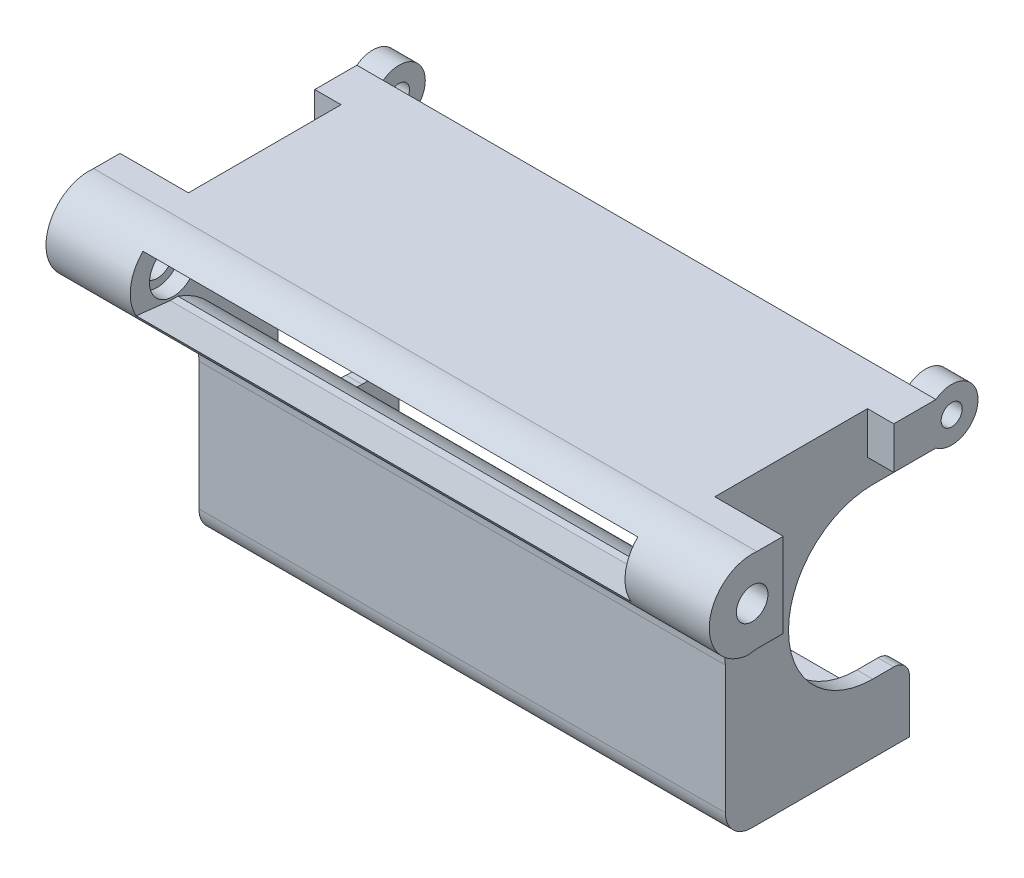
from build123d import *

# Parameters (mm, degrees)
SKETCH_1_W                = 126
SKETCH_1_H                = 16
SKETCH_1_W_2              = 120
SKETCH_1_H_2              = 10
EXTRUDE_1_DEPTH           = 70
SKETCH_2_W                = 5.409722794
SKETCH_2_H                = 10
EXTRUDE_2_DEPTH           = 70
FILLET_4_R                = 3
FILLET_5_R                = 3
SKETCH_5_W                = 9
SKETCH_5_H                = 7
SKETCH_5_R                = 1.6
EXTRUDE_3_DEPTH           = 4
FILLET_7_R                = 2
CUT_EXTRUDE_2_DEPTH       = 4
FILLET_11_R               = 2
FILLET_12_R               = 2
SKETCH_9_W                = 126
SKETCH_9_H                = 16
SKETCH_9_W_2              = 120
SKETCH_9_H_2              = 10
EXTRUDE_4_DEPTH           = 5
SKETCH_10_W               = 100
SKETCH_10_H               = 16
SKETCH_10_W_2             = 94
SKETCH_10_H_2             = 10
EXTRUDE_5_DEPTH           = 7
SKETCH_11_W               = 10
SKETCH_11_H               = 10
EXTRUDE_6_DEPTH           = 5
SKETCH_13_W               = 28
SKETCH_13_H               = 58
EXTRUDE_7_DEPTH           = 100
SKETCH_14_W               = 94
SKETCH_14_H               = 52
CUT_EXTRUDE_3_DEPTH       = 25
SKETCH_15_W               = 94
SKETCH_15_H               = 10
CUT_EXTRUDE_4_DEPTH       = 32
SKETCH_18_W               = 40
SKETCH_18_H               = 18
CUT_EXTRUDE_6_DEPTH       = 12
SKETCH_20_R               = 16
CUT_EXTRUDE_8_DEPTH       = 150.278263655
FILLET_14_R               = 3
FILLET_15_R               = 15
FILLET_16_R               = 15
CUT_EXTRUDE_9_DEPTH       = 35
SKETCH_23_W               = 13
SKETCH_23_H               = 5
SKETCH_23_W_2             = 10
EXTRUDE_9_DEPTH           = 5.761663039
EXTRUDE_10_REACH          = 162.078
SKETCH_27_W               = 94
SKETCH_27_H               = 10
CUT_EXTRUDE_11_DEPTH      = 5
SKETCH_29_W               = 9
SKETCH_29_H               = 7
SKETCH_29_R               = 1.6
EXTRUDE_11_DEPTH          = 4
FILLET_19_R               = 2
FILLET_20_R               = 2
FILLET_21_R               = 5
FILLET_22_R               = 5
CUT_EXTRUDE_12_DEPTH      = 161.078105936
CUT_EXTRUDE_12_DEPTH_BACK = 161.078105936
SKETCH_30_W               = 79.362273543
SKETCH_30_H               = 24.541256895
EXTRUDE_12_DEPTH          = 7
SKETCH_32_W               = 8.862682936
SKETCH_32_H               = 4
SKETCH_32_W_2             = 8.304403695
SKETCH_32_W_3             = 4.885807457
EXTRUDE_13_DEPTH          = 7
FILLET_23_R               = 2
FILLET_24_R               = 2
SKETCH_33_W               = 3
SKETCH_33_H               = 10
EXTRUDE_14_DEPTH          = 3
FILLET_25_R               = 3
FILLET_26_R               = 3
CUT_EXTRUDE_13_DEPTH      = 94
FILLET_27_R               = 30
SKETCH_35_W               = 3
SKETCH_35_H               = 5.761663039
EXTRUDE_15_DEPTH          = 5
SKETCH_36_W               = 19.403714678
SKETCH_36_H               = 18.643079651
SKETCH_36_W_2             = 20.912307645
SKETCH_36_H_2             = 24.781751374
CUT_EXTRUDE_14_DEPTH      = 10
EXTRUDE_16_DEPTH          = 126
SKETCH_38_W               = 94
SKETCH_38_H               = 10.061832231
CUT_EXTRUDE_15_DEPTH      = 10
SKETCH_39_R               = 4.5
CUT_EXTRUDE_16_DEPTH      = 50
CUT_EXTRUDE_17_DEPTH      = 146.189531303
CUT_EXTRUDE_17_DEPTH_BACK = 146.189531303
SKETCH_40_R               = 3
SKETCH_41_W               = 3
SKETCH_41_H               = 8
EXTRUDE_17_DEPTH          = 5
CUT_EXTRUDE_18_DEPTH      = 138.364478669
CUT_EXTRUDE_18_DEPTH_BACK = 138.364478669
SKETCH_42_R               = 2


with BuildPart() as part:
    # 草图1 → 凸台-拉伸1 (new body)
    with BuildSketch(Plane.XY):
        Rectangle(SKETCH_1_W, SKETCH_1_H)
        Rectangle(SKETCH_1_W_2, SKETCH_1_H_2, mode=Mode.SUBTRACT)
    extrude(amount=EXTRUDE_1_DEPTH)

    # 草图2 → 凸台-拉伸2 (add)
    with BuildSketch(Plane.XY.offset(70)):
        Rectangle(SKETCH_2_W, SKETCH_2_H)
    extrude(amount=-EXTRUDE_2_DEPTH)

    # 圆角4
    fillet_4_edges = [part.edges().sort_by_distance(p)[0] for p in [
        (-2.704861397, -5, 35),
    ]]
    fillet(fillet_4_edges, radius=FILLET_4_R)

    # 圆角5
    fillet_5_edges = [part.edges().sort_by_distance(p)[0] for p in [
        (-2.704861397, 5, 35),
    ]]
    fillet(fillet_5_edges, radius=FILLET_5_R)

    # 草图5 → 凸台-拉伸3 (add)
    with BuildSketch(Plane(origin=(0, 0, 2), x_dir=(-1, 0, 0), z_dir=(0, 0, -1))):
        with Locations((-67.5, 0)):
            Rectangle(SKETCH_5_W, SKETCH_5_H)
        with Locations((-69, 0)):
            Circle(SKETCH_5_R, mode=Mode.SUBTRACT)
    extrude(amount=-EXTRUDE_3_DEPTH)

    # 圆角7
    fillet_7_edges = [part.edges().sort_by_distance(p)[0] for p in [
        (72, -3.5, 4),
        (72, 3.5, 4),
        (63, 3.5, 4),
        (63, -3.5, 4),
    ]]
    fillet(fillet_7_edges, radius=FILLET_7_R)

    # 镜向8: part across plane


with BuildPart() as part_1:
    add(part.part)
    add(part.part.mirror(Plane(origin=(0, 0, 0), x_dir=(0, 0, 1), z_dir=(1, 0, 0))))

    # 镜向11: part across plane


with BuildPart() as part_2:
    add(part_1.part)
    add(part_1.part.mirror(Plane(origin=(0, 0, 35), x_dir=(1, 0, 0), z_dir=(0, 0, -1))))

    # 草图7 → 切除-拉伸2 (cut)
    with BuildSketch(Plane.XZ.offset(8)):
        with BuildLine():
            Line((-43.6, 21), (-43.6, 9))
            ThreePointArc((-43.6, 9), (-42, 7.4), (-40.4, 9))
            Line((-40.4, 9), (-40.4, 21))
            ThreePointArc((-40.4, 21), (-42, 22.6), (-43.6, 21))
        make_face()
        with BuildLine():
            Line((-26.6, 21), (-26.6, 9))
            ThreePointArc((-26.6, 9), (-25, 7.4), (-23.4, 9))
            Line((-23.4, 9), (-23.4, 21))
            ThreePointArc((-23.4, 21), (-25, 22.6), (-26.6, 21))
        make_face()
        with BuildLine():
            Line((23.4, 21), (23.4, 9))
            ThreePointArc((23.4, 9), (25, 7.4), (26.6, 9))
            Line((26.6, 9), (26.6, 21))
            ThreePointArc((26.6, 21), (25, 22.6), (23.4, 21))
        make_face()
        with BuildLine():
            Line((40.4, 21), (40.4, 9))
            ThreePointArc((40.4, 9), (42, 7.4), (43.6, 9))
            Line((43.6, 9), (43.6, 21))
            ThreePointArc((43.6, 21), (42, 22.6), (40.4, 21))
        make_face()
    extrude(amount=-CUT_EXTRUDE_2_DEPTH, mode=Mode.SUBTRACT)

    # 圆角11
    fillet_11_edges = [part_2.edges().sort_by_distance(p)[0] for p in [
        (2.704861397, 0, 0),
        (32.852430699, -5, 0),
        (3.583541054, -4.121320344, 0),
        (3.583541054, 4.121320344, 0),
        (-60, 0, 0),
        (-32.852430699, -5, 0),
        (60, 0, 0),
        (32.852430699, 5, 0),
        (-3.583541054, -4.121320344, 0),
        (-32.852430699, 5, 0),
        (-2.704861397, 0, 0),
        (-3.583541054, 4.121320344, 0),
    ]]
    fillet(fillet_11_edges, radius=FILLET_11_R)

    # 圆角12
    fillet_12_edges = [part_2.edges().sort_by_distance(p)[0] for p in [
        (2.704861397, 0, 70),
        (32.852430699, -5, 70),
        (3.583541054, -4.121320344, 70),
        (3.583541054, 4.121320344, 70),
        (-60, 0, 70),
        (-32.852430699, -5, 70),
        (60, 0, 70),
        (32.852430699, 5, 70),
        (-3.583541054, -4.121320344, 70),
        (-32.852430699, 5, 70),
        (-2.704861397, 0, 70),
        (-3.583541054, 4.121320344, 70),
    ]]
    fillet(fillet_12_edges, radius=FILLET_12_R)

    # 草图30 → 切除-拉伸12 (cut, two sides: drawn at the far end of the back side and taken through both)
    with BuildSketch(Plane(origin=(63, 0, 0), x_dir=(0, 0, -1), z_dir=(1, 0, 0)).offset(-CUT_EXTRUDE_12_DEPTH_BACK)):
        with Locations((-36.613921576, 1.105672462)):
            Rectangle(SKETCH_30_W, SKETCH_30_H)
    extrude(amount=CUT_EXTRUDE_12_DEPTH + CUT_EXTRUDE_12_DEPTH_BACK, mode=Mode.SUBTRACT)


with BuildPart() as body_2:
    # 草图9 → 凸台-拉伸4 (new body)
    with BuildSketch(Plane(origin=(0, 0, -10), x_dir=(-1, 0, 0), z_dir=(0, 0, -1))):
        Rectangle(SKETCH_9_W, SKETCH_9_H)
        Rectangle(SKETCH_9_W_2, SKETCH_9_H_2, mode=Mode.SUBTRACT)
    extrude(amount=EXTRUDE_4_DEPTH)

    # 草图10 → 凸台-拉伸5 (add)
    with BuildSketch(Plane(origin=(0, 0, -10), x_dir=(-1, 0, 0), z_dir=(0, 0, -1))):
        Rectangle(SKETCH_10_W, SKETCH_10_H)
        Rectangle(SKETCH_10_W_2, SKETCH_10_H_2, mode=Mode.SUBTRACT)
    extrude(amount=EXTRUDE_5_DEPTH)

    # 草图11 → 凸台-拉伸6 (add)
    with BuildSketch(Plane(origin=(0, 0, -15), x_dir=(-1, 0, 0), z_dir=(0, 0, -1))):
        with Locations((55, 0)):
            Rectangle(SKETCH_11_W, SKETCH_11_H)
        with Locations((-55, 0)):
            Rectangle(SKETCH_11_W, SKETCH_11_H)
    extrude(amount=-EXTRUDE_6_DEPTH)

    # 草图13 → 凸台-拉伸7 (add)
    with BuildSketch(Plane.ZY.offset(50)):
        with Locations((-31, -21)):
            Rectangle(SKETCH_13_W, SKETCH_13_H)
    extrude(amount=-EXTRUDE_7_DEPTH)

    # 草图14 → 切除-拉伸3 (cut)
    with BuildSketch(Plane(origin=(0, 0, -45), x_dir=(-1, 0, 0), z_dir=(0, 0, -1))):
        with Locations((0, -21)):
            Rectangle(SKETCH_14_W, SKETCH_14_H)
    extrude(amount=-CUT_EXTRUDE_3_DEPTH, mode=Mode.SUBTRACT)

    # 草图15 → 切除-拉伸4 (cut)
    with BuildSketch(Plane.XY.offset(-17)):
        Rectangle(SKETCH_15_W, SKETCH_15_H)
    extrude(amount=-CUT_EXTRUDE_4_DEPTH, mode=Mode.SUBTRACT)

    # 草图18 → 切除-拉伸6 (cut)
    with BuildSketch(Plane.XZ.offset(50)):
        with Locations((0, -36)):
            Rectangle(SKETCH_18_W, SKETCH_18_H)
    extrude(amount=-CUT_EXTRUDE_6_DEPTH, mode=Mode.SUBTRACT)

    # 草图20 → 切除-拉伸8 (cut, through all)
    with BuildSketch(Plane(origin=(50, 0, 0), x_dir=(0, 0, -1), z_dir=(1, 0, 0))):
        with Locations((45, -21)):
            Circle(SKETCH_20_R)
    extrude(amount=-CUT_EXTRUDE_8_DEPTH, mode=Mode.SUBTRACT)

    # 圆角14
    fillet_14_edges = [body_2.edges().sort_by_distance(p)[0] for p in [
        (-20, -48.5, -27),
        (20, -48.5, -27),
        (20, -48.5, -45),
        (-20, -48.5, -45),
    ]]
    fillet(fillet_14_edges, radius=FILLET_14_R)

    # 圆角15
    # the kernel refuses this fillet: 15 mm, written as the material it adds along each edge
    with BuildSketch(Plane(origin=(-81.721443851, -8, -17), x_dir=(0, -1, 0), z_dir=(1, 0, 0))) as fillet_15_piece_1_section:
        with BuildLine():
            CenterArc((12.68857754, -15), FILLET_15_R, 90, 57.769047364)
            Line((0, -7), (-0.253771551, -6.84))
            ThreePointArc((-0.253771551, -6.84), (-0.3, -3.5), (-0.3, 0))
            Line((-0.3, 0), (0, 0.3))
            Line((0, 0.3), (12.68857754, 0.3))
            Line((12.68857754, 0.3), (12.68857754, 0))
        make_face()
    fillet_15_piece_1 = extrude(amount=131.721443851, mode=Mode.PRIVATE)
    fillet_15_piece_1 = split(fillet_15_piece_1, bisect_by=Plane(origin=(-50, -9.390389411, -13.373048473), z_dir=(-1, 0, 0)), keep=Keep.TOP, mode=Mode.PRIVATE)
    fillet_15_piece_1 = split(fillet_15_piece_1, bisect_by=Plane(origin=(-63, -9.390389411, -13.373048473), z_dir=(1, 0, 0)), keep=Keep.TOP, mode=Mode.PRIVATE)
    fillet_15_piece_1 = split(fillet_15_piece_1, bisect_by=Plane(origin=(-56.5, -9.390389411, -15), z_dir=(0, 0, 1)), keep=Keep.TOP, mode=Mode.PRIVATE)
    add(fillet_15_piece_1)
    with BuildSketch(Plane(origin=(-50, -8, -17), x_dir=(0, -1, 0), z_dir=(1, 0, 0))) as fillet_15_piece_2_section:
        with BuildLine():
            CenterArc((12.68857754, -15), FILLET_15_R, 90, 57.769047365)
            Line((0, -7), (-0.253771551, -6.84))
            ThreePointArc((-0.253771551, -6.84), (-0.3, -3.5), (-0.3, 0))
            Line((-0.3, 0), (0, 0.3))
            Line((0, 0.3), (12.68857754, 0.3))
            Line((12.68857754, 0.3), (12.68857754, 0))
        make_face()
    fillet_15_piece_2 = extrude(amount=100, mode=Mode.PRIVATE)
    fillet_15_piece_2 = split(fillet_15_piece_2, bisect_by=Plane(origin=(0, -12.327149121, -15), z_dir=(0, 0, -1)), keep=Keep.TOP, mode=Mode.PRIVATE)
    add(fillet_15_piece_2)
    with BuildSketch(Plane(origin=(-50, -8, -17), x_dir=(0, -1, 0), z_dir=(1, 0, 0))) as fillet_15_piece_3_section:
        with BuildLine():
            CenterArc((12.68857754, -15), FILLET_15_R, 90, 57.769047365)
            Line((0, -7), (-0.253771551, -6.84))
            ThreePointArc((-0.253771551, -6.84), (-0.3, -3.5), (-0.3, 0))
            Line((-0.3, 0), (0, 0.3))
            Line((0, 0.3), (12.68857754, 0.3))
            Line((12.68857754, 0.3), (12.68857754, 0))
        make_face()
    fillet_15_piece_3 = extrude(amount=100, mode=Mode.PRIVATE)
    fillet_15_piece_3 = split(fillet_15_piece_3, bisect_by=Plane(origin=(0, -9.390389411, -15), z_dir=(0, 0, 1)), keep=Keep.TOP, mode=Mode.PRIVATE)
    add(fillet_15_piece_3)
    with BuildSketch(Plane(origin=(-50, -8, -17), x_dir=(0, -1, 0), z_dir=(1, 0, 0))) as fillet_15_piece_4_section:
        with BuildLine():
            CenterArc((12.68857754, -15), FILLET_15_R, 90, 57.769047365)
            Line((0, -7), (-0.253771551, -6.84))
            ThreePointArc((-0.253771551, -6.84), (-0.3, -3.5), (-0.3, 0))
            Line((-0.3, 0), (0, 0.3))
            Line((0, 0.3), (12.68857754, 0.3))
            Line((12.68857754, 0.3), (12.68857754, 0))
        make_face()
    fillet_15_piece_4 = extrude(amount=131.721443851, mode=Mode.PRIVATE)
    fillet_15_piece_4 = split(fillet_15_piece_4, bisect_by=Plane(origin=(50, -9.390389411, -13.373048473), z_dir=(1, 0, 0)), keep=Keep.TOP, mode=Mode.PRIVATE)
    fillet_15_piece_4 = split(fillet_15_piece_4, bisect_by=Plane(origin=(56.5, -9.390389411, -15), z_dir=(0, 0, 1)), keep=Keep.TOP, mode=Mode.PRIVATE)
    fillet_15_piece_4 = split(fillet_15_piece_4, bisect_by=Plane(origin=(63, -9.390389411, -13.373048473), z_dir=(-1, 0, 0)), keep=Keep.TOP, mode=Mode.PRIVATE)
    add(fillet_15_piece_4)

    # 圆角16
    # the kernel refuses this fillet: 15 mm, written as the material it takes off along each edge
    with BuildSketch(Plane(origin=(-47, -5, -20), x_dir=(0, -1, 0), z_dir=(1, 0, 0))) as fillet_16_piece_1:
        with BuildLine():
            CenterArc((14.142135624, -15), FILLET_16_R, 90, 70.528779366)
            Line((0, -10), (0, 0))
            Line((0, 0), (14.142135624, 0))
        make_face()
    extrude(amount=94, mode=Mode.SUBTRACT)

    # 草图22 → 切除-拉伸9 (cut)
    with BuildSketch(Plane(origin=(0, 0, -10), x_dir=(-1, 0, 0), z_dir=(0, 0, -1))):
        Polygon((-50, -2.238336961), (-63, -2.238336961), (-70.122291953, -2.238336961), (-70.122291953, -20.130209913), (-50, -20.130209913), align=None)
        Polygon((63, -2.238336961), (50, -2.238336961), (50, -24.248491671), (70.402947552, -24.248491671), (70.402947552, -2.238336961), align=None)
    extrude(amount=CUT_EXTRUDE_9_DEPTH, mode=Mode.SUBTRACT)

    # 草图23 → 凸台-拉伸9 (add)
    with BuildSketch(Plane.XZ.offset(2.238336961)):
        with Locations((56.5, -12.5)):
            Rectangle(SKETCH_23_W, SKETCH_23_H)
        with Locations((-58, -12.5)):
            Rectangle(SKETCH_23_W_2, SKETCH_23_H)
    extrude(amount=EXTRUDE_9_DEPTH)

    # 凸台-拉伸10: up to this face of the body (flat: up to its plane)
    extrude_10_end = Plane(body_2.part.faces().sort_by_distance((63, 0, -12.5))[0])
    # 草图26 → 凸台-拉伸10 (add, up to the picked face)
    with BuildSketch(Plane.ZY.offset(63), mode=Mode.PRIVATE) as extrude_10_sk1:
        Polygon((-10, -8), (-10, 8), (-8.195004029, -8.206285254), align=None)
    extrude_10_tool1 = split(extrude(extrude_10_sk1.sketch, amount=-EXTRUDE_10_REACH, mode=Mode.PRIVATE), bisect_by=extrude_10_end, keep=Keep.BOTH, mode=Mode.PRIVATE)
    add(extrude_10_tool1.solids().sort_by(Axis((-63, -2.735428, -9.398335), (1, 0, 0)))[0])

    # 草图27 → 切除-拉伸11 (cut)
    with BuildSketch(Plane(origin=(0, 0, -10), x_dir=(-1, 0, 0), z_dir=(0, 0, -1))):
        Rectangle(SKETCH_27_W, SKETCH_27_H)
    extrude(amount=-CUT_EXTRUDE_11_DEPTH, mode=Mode.SUBTRACT)

    # 草图29 → 凸台-拉伸11 (add)
    # profile 1 of 2: a face of its own
    with BuildSketch(Plane(origin=(0, -1.555554136, -13.966653921), x_dir=(1, 0, 0), z_dir=(0, 0.11069186028527712, 0.993854774132813))):
        with Locations((-67.5, 1.660377904)):
            Rectangle(SKETCH_29_W, SKETCH_29_H)
        with Locations(Location((-69, 1.660377904, 0), (0, 0, 270))):
            Circle(SKETCH_29_R, mode=Mode.SUBTRACT)
    # profile 2 of 2: a face of its own
    with BuildSketch(Plane(origin=(0, -1.555554136, -13.966653921), x_dir=(1, 0, 0), z_dir=(0, 0.11069186028527712, 0.993854774132813))):
        with Locations((67.5, 1.660377904)):
            Rectangle(SKETCH_29_W, SKETCH_29_H)
        with Locations(Location((69, 1.660377904, 0), (0, 0, 270))):
            Circle(SKETCH_29_R, mode=Mode.SUBTRACT)
    extrude(amount=EXTRUDE_11_DEPTH)

    # 圆角19
    fillet_19_edges = [body_2.edges().sort_by_distance(p)[0] for p in [
        (63, -3.162487618, -11.775313181),
        (72, -3.162487618, -11.775313181),
        (72, 3.794495801, -12.550156203),
        (63, 3.794495801, -12.550156203),
    ]]
    fillet(fillet_19_edges, radius=FILLET_19_R)

    # 圆角20
    fillet_20_edges = [body_2.edges().sort_by_distance(p)[0] for p in [
        (-63, -3.162487618, -11.775313181),
        (-63, 3.794495801, -12.550156203),
        (-72, 3.794495801, -12.550156203),
        (-72, -3.162487618, -11.775313181),
    ]]
    fillet(fillet_20_edges, radius=FILLET_20_R)

    # 圆角21
    fillet_21_edges = [body_2.edges().sort_by_distance(p)[0] for p in [
        (0, -50, -17),
    ]]
    fillet(fillet_21_edges, radius=FILLET_21_R)

    # 圆角22
    fillet_22_edges = [body_2.edges().sort_by_distance(p)[0] for p in [
        (0, -47, -20),
    ]]
    fillet(fillet_22_edges, radius=FILLET_22_R)

    # 草图31 → 凸台-拉伸12 (add)
    with BuildSketch(Plane(origin=(0, 0, -45), x_dir=(-1, 0, 0), z_dir=(0, 0, -1))):
        Polygon((47, -5), (50, -5), (50, 8), (-50, 8), (-50, -5), (-47, -5), (-47, 5), (47, 5), align=None)
        Polygon((-50, -50), (-23, -50), (-23, -47), (-47, -47), (-47, -37), (-50, -37), align=None)
        Polygon((47, -47), (23, -47), (23, -50), (50, -50), (50, -37), (47, -37), align=None)
    extrude(amount=EXTRUDE_12_DEPTH)

    # 草图32 → 凸台-拉伸13 (add)
    with BuildSketch(Plane(origin=(0, 0, -20), x_dir=(-1, 0, 0), z_dir=(0, 0, -1))):
        with Locations((39.115303361, -39)):
            Rectangle(SKETCH_32_W, SKETCH_32_H)
        with Locations((21.25036768, -39)):
            Rectangle(SKETCH_32_W_2, SKETCH_32_H)
        with Locations((2.442903729, -39)):
            Rectangle(SKETCH_32_W_3, SKETCH_32_H)
        with Locations((-2.442903729, -39)):
            Rectangle(SKETCH_32_W_3, SKETCH_32_H)
        with Locations((-21.25036768, -39)):
            Rectangle(SKETCH_32_W_2, SKETCH_32_H)
        with Locations((-39.115303361, -39)):
            Rectangle(SKETCH_32_W, SKETCH_32_H)
    extrude(amount=EXTRUDE_13_DEPTH)

    # 圆角23
    fillet_23_edges = [body_2.edges().sort_by_distance(p)[0] for p in [
        (-43.546644829, -39, -20),
        (-34.683961893, -39, -20),
        (-25.402569528, -39, -20),
        (-17.098165833, -39, -20),
        (4.885807457, -39, -20),
        (-4.885807457, -39, -20),
        (17.098165833, -39, -20),
        (25.402569528, -39, -20),
        (34.683961893, -39, -20),
        (43.546644829, -39, -20),
    ]]
    fillet(fillet_23_edges, radius=FILLET_23_R)

    # 圆角24
    fillet_24_edges = [body_2.edges().sort_by_distance(p)[0] for p in [
        (-34.683961893, -39, -27),
        (-43.546644829, -39, -27),
        (-17.098165833, -39, -27),
        (-25.402569528, -39, -27),
        (-4.885807457, -39, -27),
        (4.885807457, -39, -27),
        (25.402569528, -39, -27),
        (17.098165833, -39, -27),
        (43.546644829, -39, -27),
        (34.683961893, -39, -27),
    ]]
    fillet(fillet_24_edges, radius=FILLET_24_R)

    # 草图33 → 凸台-拉伸14 (add)
    with BuildSketch(Plane.XZ.offset(50)):
        with Locations((-21.5, -47)):
            Rectangle(SKETCH_33_W, SKETCH_33_H)
        with Locations((21.5, -47)):
            Rectangle(SKETCH_33_W, SKETCH_33_H)
    extrude(amount=-EXTRUDE_14_DEPTH)

    # 圆角25
    fillet_25_edges = [body_2.edges().sort_by_distance(p)[0] for p in [
        (-20, -48.5, -52),
        (20, -48.5, -52),
    ]]
    fillet(fillet_25_edges, radius=FILLET_25_R)

    # 圆角26
    fillet_26_edges = [body_2.edges().sort_by_distance(p)[0] for p in [
        (-48.5, -5, -52),
        (48.5, -5, -52),
        (48.5, -37, -52),
        (-48.5, -37, -52),
    ]]
    fillet(fillet_26_edges, radius=FILLET_26_R)

    # 草图34 → 切除-拉伸13 (cut)
    with BuildSketch(Plane(origin=(-47, 0, 0), x_dir=(0, 0, -1), z_dir=(1, 0, 0))):
        Polygon((52, 7.6), (36.789103291, 5), (52, 5), align=None)
    extrude(amount=CUT_EXTRUDE_13_DEPTH, mode=Mode.SUBTRACT)

    # 圆角27
    fillet_27_edges = [body_2.edges().sort_by_distance(p)[0] for p in [
        (0, 5, -36.789103291),
    ]]
    fillet(fillet_27_edges, radius=FILLET_27_R)

    # 草图35 → 凸台-拉伸15 (add)
    with BuildSketch(Plane(origin=(0, 0, -15), x_dir=(-1, 0, 0), z_dir=(0, 0, -1))):
        with Locations((51.5, -5.11916848)):
            Rectangle(SKETCH_35_W, SKETCH_35_H)
    extrude(amount=-EXTRUDE_15_DEPTH)

    # 草图36 → 切除-拉伸14 (cut)
    with BuildSketch(Plane(origin=(0, -1.002094835, -8.99738005), x_dir=(1, 0, 0), z_dir=(0, 0.11069186028527712, 0.993854774132813))):
        with Locations((-72.701857339, 2.07280429)):
            Rectangle(SKETCH_36_W, SKETCH_36_H)
        with Locations((73.456153822, 5.142140151)):
            Rectangle(SKETCH_36_W_2, SKETCH_36_H_2)
    extrude(amount=-CUT_EXTRUDE_14_DEPTH, mode=Mode.SUBTRACT)

    # 草图37 → 凸台-拉伸16 (add)
    with BuildSketch(Plane(origin=(63, 0, 0), x_dir=(0, 0, -1), z_dir=(1, 0, 0))):
        with BuildLine():
            Line((8.195004029, -8.206285254), (10, 8))
            ThreePointArc((10, 8), (0.994359388, 0.799355359), (8.195004029, -8.206285254))
        make_face()
    extrude(amount=-EXTRUDE_16_DEPTH)

    # 草图38 → 切除-拉伸15 (cut)
    with BuildSketch(Plane(origin=(0, -1.002094835, -8.99738005), x_dir=(-1, 0, 0), z_dir=(0, -0.11069186028527703, -0.993854774132813))):
        with Locations((0, 1.00829101)):
            Rectangle(SKETCH_38_W, SKETCH_38_H)
    extrude(amount=-CUT_EXTRUDE_15_DEPTH, mode=Mode.SUBTRACT)

    # 草图39 → 切除-拉伸16 (cut, symmetric)
    with BuildSketch(Plane(origin=(0, 0, 0), x_dir=(0, 0, -1), z_dir=(1, 0, 0))):
        with Locations((9.097502015, -0.103142627)):
            Circle(SKETCH_39_R)
    extrude(amount=CUT_EXTRUDE_16_DEPTH, both=True, mode=Mode.SUBTRACT)

    # 草图40 → 切除-拉伸17 (cut, two sides: drawn at the far end of the back side and taken through both)
    with BuildSketch(Plane.ZY.offset(63).offset(-CUT_EXTRUDE_17_DEPTH_BACK)):
        with Locations(Location((-9.097502015, -0.103142627, 0), (0, 0, 180))):
            Circle(SKETCH_40_R)
    extrude(amount=CUT_EXTRUDE_17_DEPTH + CUT_EXTRUDE_17_DEPTH_BACK, mode=Mode.SUBTRACT)

    # 草图41 → 凸台-拉伸17 (add)
    with BuildSketch(Plane(origin=(50, 0, 0), x_dir=(0, 0, -1), z_dir=(1, 0, 0))):
        with BuildLine():
            Line((52, 8), (44, 8))
            Line((44, 8), (44, 0))
            Line((44, 0), (52, 0))
            ThreePointArc((52, 0), (50, 4), (52, 8))
        make_face()
        with BuildLine():
            ThreePointArc((60, 4), (57.236067977, 8.472135955), (52, 8))
            Line((52, 8), (55, 8))
            Line((55, 8), (55, 0))
            Line((55, 0), (52, 0))
            ThreePointArc((52, 0), (57.236067977, -0.472135955), (60, 4))
        make_face()
        with Locations((53.5, 4)):
            Rectangle(SKETCH_41_W, SKETCH_41_H)
        with BuildLine():
            Line((52, 0), (52, 8))
            ThreePointArc((52, 8), (50, 4), (52, 0))
        make_face()
    extrude_17 = extrude(amount=EXTRUDE_17_DEPTH)

    # 镜向12: 凸台-拉伸17 across plane
    add(extrude_17.mirror(Plane(origin=(0, 0, 0), x_dir=(0, 0, 1), z_dir=(1, 0, 0))))

    # 草图42 → 切除-拉伸18 (cut, two sides: drawn at the far end of the back side and taken through both)
    with BuildSketch(Plane(origin=(-50, 0, 0), x_dir=(0, 0, -1), z_dir=(1, 0, 0)).offset(-CUT_EXTRUDE_18_DEPTH_BACK)):
        with Locations(Location((55, 4, 0), (0, 0, 180))):
            Circle(SKETCH_42_R)
    extrude(amount=CUT_EXTRUDE_18_DEPTH + CUT_EXTRUDE_18_DEPTH_BACK, mode=Mode.SUBTRACT)


solid = body_2.part
